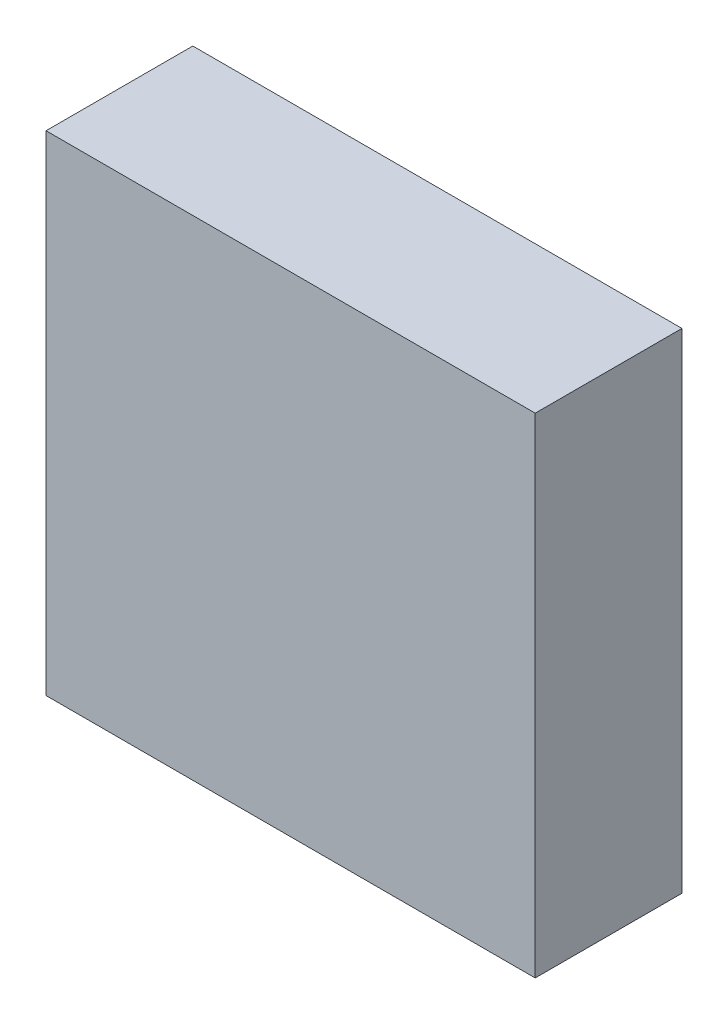
from build123d import *

# Parameters (mm, degrees)
SKETCH1_W           = 100
SKETCH1_H           = 100
BOSS_EXTRUDE1_DEPTH = 30


with BuildPart() as part:
    # Sketch1 → Boss-Extrude1 (new body)
    with BuildSketch(Plane.XY):
        with Locations((-25.636160714, -1.986607143)):
            Rectangle(SKETCH1_W, SKETCH1_H)
    extrude(amount=BOSS_EXTRUDE1_DEPTH)


solid = part.part
